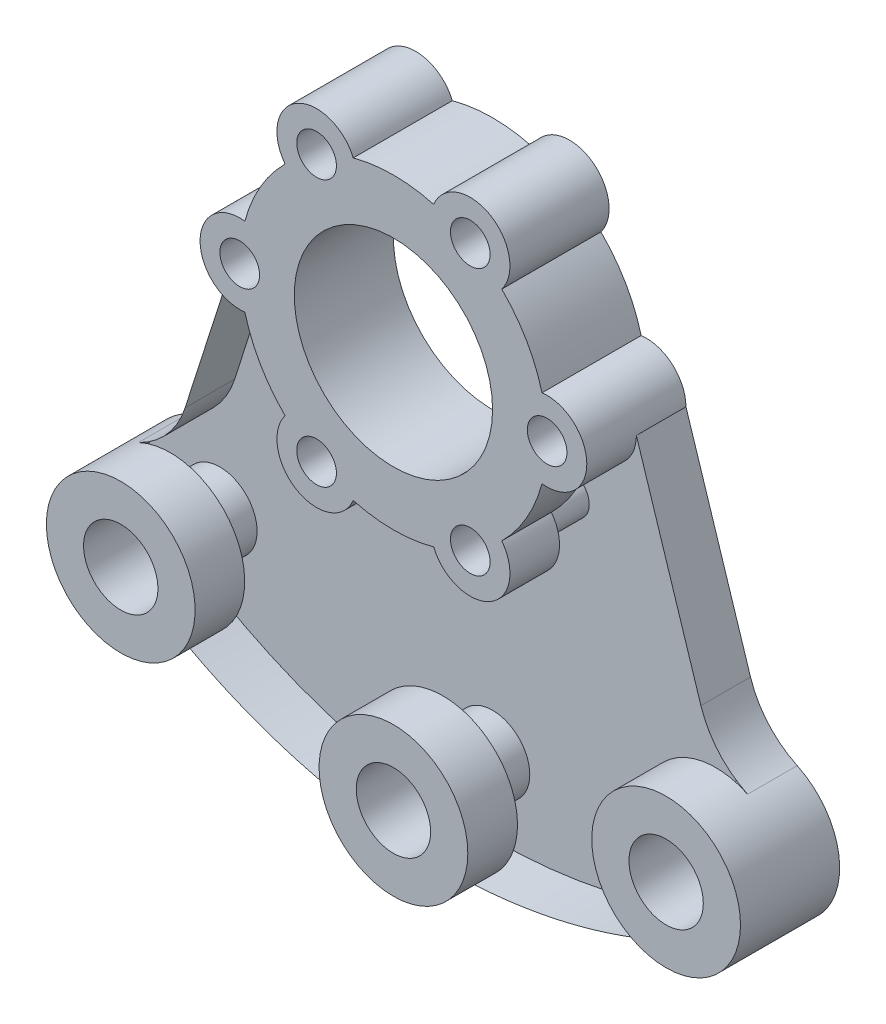
from build123d import *
from build123d.topology import SkipClean

# Parameters (mm, degrees)
CROQUIS1_R                = 15
CROQUIS1_R_2              = 7.5
SALIENTE_EXTRUIR1_DEPTH   = 20
SALIENTE_EXTRUIR1_2_DEPTH = 20
SALIENTE_EXTRUIR1_3_DEPTH = 20
CROQUIS1_R_3              = 20
CROQUIS1_R_4              = 4
SALIENTE_EXTRUIR1_4_DEPTH = 20
SALIENTE_EXTRUIR2_DEPTH   = 10
CORTAR_EXTRUIR2_START     = -10
CORTAR_EXTRUIR2_DEPTH     = 10
CORTAR_EXTRUIR3_START     = -10
CROQUIS6_R                = 7.5
CROQUIS6_R_2              = 4
CORTAR_EXTRUIR3_DEPTH     = 10


with BuildPart() as part:
    # Croquis1 → Saliente-Extruir1 (new body)
    with BuildSketch(Plane.XY):
        with Locations((0, -80)):
            Circle(CROQUIS1_R)
        with Locations((0, -80)):
            Circle(CROQUIS1_R_2, mode=Mode.SUBTRACT)
    extrude(amount=SALIENTE_EXTRUIR1_DEPTH)



with BuildPart() as body_2:
    # Croquis1 → Saliente-Extruir1 2 (new body)
    with BuildSketch(Plane.XY):
        with Locations((55, -65)):
            Circle(CROQUIS1_R)
        with Locations((55, -65)):
            Circle(CROQUIS1_R_2, mode=Mode.SUBTRACT)
    extrude(amount=SALIENTE_EXTRUIR1_2_DEPTH)


with BuildPart() as body_3:
    # Croquis1 → Saliente-Extruir1 3 (new body)
    with BuildSketch(Plane.XY):
        with Locations((-55, -65)):
            Circle(CROQUIS1_R)
        with Locations((-55, -65)):
            Circle(CROQUIS1_R_2, mode=Mode.SUBTRACT)
    extrude(amount=SALIENTE_EXTRUIR1_3_DEPTH)


with BuildPart() as body_4:
    # Croquis1 → Saliente-Extruir1 4 (new body)
    with BuildSketch(Plane.XY):
        with BuildLine():
            ThreePointArc((29.967741935, -7.933123174), (39, 0), (29.967741935, 7.933123174))
            ThreePointArc((29.967741935, 7.933123174), (26.846787517, 15.5), (21.854157167, 21.986264223))
            ThreePointArc((21.854157167, 21.986264223), (19.5, 33.774990748), (8.113584768, 29.919387397))
            ThreePointArc((8.113584768, 29.919387397), (0, 31), (-8.113584768, 29.919387397))
            ThreePointArc((-8.113584768, 29.919387397), (-19.5, 33.774990748), (-21.854157167, 21.986264223))
            ThreePointArc((-21.854157167, 21.986264223), (-26.846787517, 15.5), (-29.967741935, 7.933123174))
            ThreePointArc((-29.967741935, 7.933123174), (-39, 0), (-29.967741935, -7.933123174))
            ThreePointArc((-29.967741935, -7.933123174), (-26.846787517, -15.5), (-21.854157167, -21.986264223))
            ThreePointArc((-21.854157167, -21.986264223), (-19.5, -33.774990748), (-8.113584768, -29.919387397))
            ThreePointArc((-8.113584768, -29.919387397), (0, -31), (8.113584768, -29.919387397))
            ThreePointArc((8.113584768, -29.919387397), (19.5, -33.774990748), (21.854157167, -21.986264223))
            ThreePointArc((21.854157167, -21.986264223), (26.846787517, -15.5), (29.967741935, -7.933123174))
        make_face()
        Circle(CROQUIS1_R_3, mode=Mode.SUBTRACT)
        with Locations((31, 0)):
            Circle(CROQUIS1_R_4, mode=Mode.SUBTRACT)
        with Locations((15.5, -26.846787517)):
            Circle(CROQUIS1_R_4, mode=Mode.SUBTRACT)
        with Locations((-15.5, -26.846787517)):
            Circle(CROQUIS1_R_4, mode=Mode.SUBTRACT)
        with Locations((-31, 0)):
            Circle(CROQUIS1_R_4, mode=Mode.SUBTRACT)
        with Locations((-15.5, 26.846787517)):
            Circle(CROQUIS1_R_4, mode=Mode.SUBTRACT)
        with Locations((15.5, 26.846787517)):
            Circle(CROQUIS1_R_4, mode=Mode.SUBTRACT)
    extrude(amount=SALIENTE_EXTRUIR1_4_DEPTH)


with BuildPart() as part_1:
    with SkipClean():  # the faces are left unmerged after this step: merging them gives an invalid solid
        add(part.part)

        add(body_2.part)  # Saliente-Extruir2 merges body 2

        add(body_3.part)  # Saliente-Extruir2 merges body 3

        add(body_4.part)  # Saliente-Extruir2 merges body 4
        # Croquis2 → Saliente-Extruir2 (add)
        with BuildSketch(Plane.XY):
            with BuildLine():
                Line((39, 0), (52.017194873, -40.678733978))
                ThreePointArc((52.017194873, -40.678733978), (55.61045151, -47.041283696), (61.436740692, -51.451259495))
                ThreePointArc((61.436740692, -51.451259495), (69.632687852, -68.29915841), (55, -80))
                ThreePointArc((55, -80), (0, -95), (-55, -80))
                ThreePointArc((-55, -80), (-69.632687852, -68.29915841), (-61.436740692, -51.451259495))
                ThreePointArc((-61.436740692, -51.451259495), (-55.61045151, -47.041283696), (-52.017194873, -40.678733978))
                Line((-52.017194873, -40.678733978), (-39, 0))
                Line((-39, 0), (39, 0))
            make_face()
        extrude(amount=SALIENTE_EXTRUIR2_DEPTH)

    # Croquis5 → Cortar-Extruir2 (cut)
    with SkipClean():  # the faces are left unmerged after this step: merging them gives an invalid solid
        with BuildSketch(Plane.XY.offset(10).offset(CORTAR_EXTRUIR2_START)):
            with BuildLine():
                Line((-20, 0), (20, 0))
                ThreePointArc((20, 0), (0, -20), (-20, 0))
            make_face()
        extrude(amount=CORTAR_EXTRUIR2_DEPTH, mode=Mode.SUBTRACT)

    # Croquis6 → Cortar-Extruir3 (cut)
    with SkipClean():  # the faces are left unmerged after this step: merging them gives an invalid solid
        with BuildSketch(Plane.XY.offset(10).offset(CORTAR_EXTRUIR3_START)):
            with Locations((-55, -65)):
                Circle(CROQUIS6_R)
            with Locations((0, -80)):
                Circle(CROQUIS6_R)
            with Locations((55, -65)):
                Circle(CROQUIS6_R)
            with Locations((15.5, -26.846787517)):
                Circle(CROQUIS6_R_2)
            with Locations((-15.5, -26.846787517)):
                Circle(CROQUIS6_R_2)
            with BuildLine():
                Line((-35, 0), (-27, 0))
                ThreePointArc((-27, 0), (-31, -4), (-35, 0))
            make_face()
            with BuildLine():
                Line((27, 0), (35, 0))
                ThreePointArc((35, 0), (31, -4), (27, 0))
            make_face()
        extrude(amount=CORTAR_EXTRUIR3_DEPTH, mode=Mode.SUBTRACT)


solid = part_1.part
